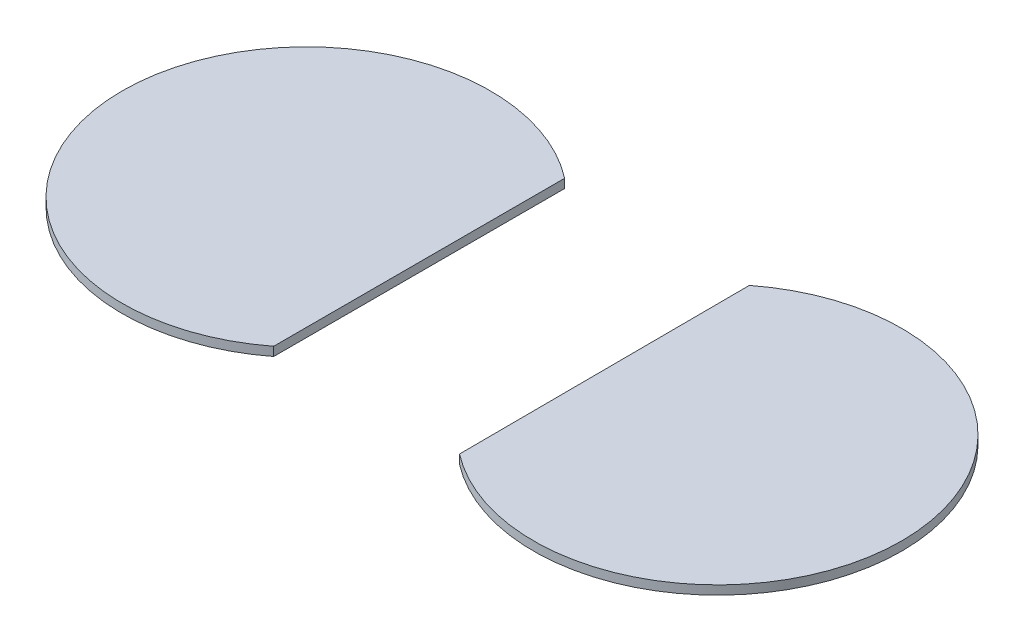
from build123d import *

# Parameters (mm, degrees)
BOSS_EXTRUDE1_DEPTH   = 0.3
BOSS_EXTRUDE1_2_DEPTH = 0.3


with BuildPart() as part:
    # Sketch1 → Boss-Extrude1 (new body)
    with BuildSketch(Plane(origin=(0, 0, 0), x_dir=(1, 0, 0), z_dir=(0, 1, 0))):
        with BuildLine():
            Line((-3.2, -4.898979486), (-3.2, 4.898979486))
            ThreePointArc((-3.2, 4.898979486), (-13.2, 0), (-3.2, -4.898979486))
        make_face()
    extrude(amount=BOSS_EXTRUDE1_DEPTH)


with BuildPart() as body_2:
    # Sketch1 → Boss-Extrude1 2 (new body)
    with BuildSketch(Plane(origin=(0, 0, 0), x_dir=(1, 0, 0), z_dir=(0, 1, 0))):
        with BuildLine():
            Line((3.034307887, 4.884394056), (3.071845277, -4.91349301))
            ThreePointArc((3.071845277, -4.91349301), (13.053003194, 0.023761962), (3.034307887, 4.884394056))
        make_face()
    extrude(amount=BOSS_EXTRUDE1_2_DEPTH)


solid = Compound([part.part, body_2.part])
